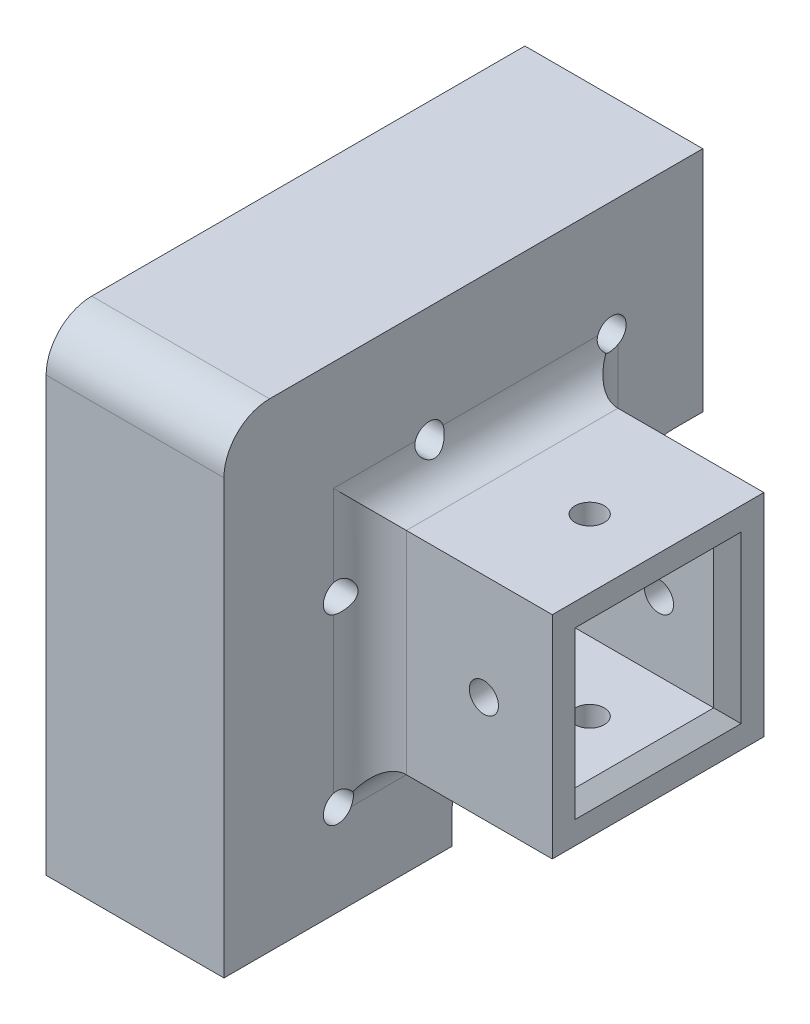
from build123d import *

# Parameters (mm, degrees)
SKETCH_1_R          = 1.6
SKETCH_1_W          = 15.2
SKETCH_1_H          = 15.2
EXTRUDE_1_DEPTH     = 19.5
CUT_EXTRUDE_1_DEPTH = 14.5
SKETCH_3_W          = 23.2
SKETCH_3_H          = 23.2
SKETCH_3_W_2        = 15.2
SKETCH_3_H_2        = 15.2
EXTRUDE_2_DEPTH     = 20
FILLET_1_R          = 4
FILLET_2_R          = 6
CHAMFER_1_SIZE      = 1.5
CHAMFER_2_SIZE      = 1
SKETCH_4_R          = 1.6
CUT_EXTRUDE_2_DEPTH = 68.026114314
SKETCH_5_R          = 1.6
CUT_EXTRUDE_3_DEPTH = 68.026114314
FILLET_3_R          = 5


with BuildPart() as part:
    # 草图1 → 凸台-拉伸1 (new body)
    with BuildSketch(Plane(origin=(0, 0, 0), x_dir=(0, 0, -1), z_dir=(1, 0, 0))):
        Polygon((12.5, -30.7), (30.7, -30.7), (30.7, -12.5), (40, -12.5), (40, 12.5), (-12.5, 12.5), (-12.5, -40), (12.5, -40), align=None)
        with Locations((10, 0)):
            Circle(SKETCH_1_R, mode=Mode.SUBTRACT)
        with Locations((30, 0)):
            Circle(SKETCH_1_R, mode=Mode.SUBTRACT)
        with Locations(Location((0, -30, 0), (0, 0, 180))):
            Circle(SKETCH_1_R, mode=Mode.SUBTRACT)
        with Locations(Location((0, -10, 0), (0, 0, 180))):
            Circle(SKETCH_1_R, mode=Mode.SUBTRACT)
        with Locations((15.1, -15.1)):
            Rectangle(SKETCH_1_W, SKETCH_1_H, mode=Mode.SUBTRACT)
    extrude(amount=EXTRUDE_1_DEPTH)

    # 草图2 → 切除-拉伸1 (cut)
    with BuildSketch(Plane.ZY):
        Polygon((7.5, 7.5), (7.5, -40), (-7.5, -40), (-7.5, -7.5), (-40, -7.5), (-40, 7.5), align=None)
    extrude(amount=-CUT_EXTRUDE_1_DEPTH, mode=Mode.SUBTRACT)

    # 草图3 → 凸台-拉伸2 (add)
    with BuildSketch(Plane(origin=(19.5, 0, 0), x_dir=(0, 0, -1), z_dir=(1, 0, 0))):
        with Locations((15.1, -15.1)):
            Rectangle(SKETCH_3_W, SKETCH_3_H)
        with Locations((15.1, -15.1)):
            Rectangle(SKETCH_3_W_2, SKETCH_3_H_2, mode=Mode.SUBTRACT)
    extrude(amount=EXTRUDE_2_DEPTH)

    # 圆角1
    # the kernel refuses this fillet: 4 mm, written as the material it adds along each edge
    with BuildSketch(Plane(origin=(19.5, -3.5, -3.5), x_dir=(0, 0, 1), z_dir=(0, -1, 0))) as fillet_1_piece_1_section:
        with BuildLine():
            CenterArc((FILLET_1_R, -FILLET_1_R), FILLET_1_R, 90, 90)
            Line((0, -FILLET_1_R), (0, 0))
            Line((0, 0), (FILLET_1_R, 0))
        make_face()
    fillet_1_piece_1 = extrude(amount=23.2, mode=Mode.PRIVATE)
    fillet_1_piece_1 = fillet_1_piece_1 - Plane(origin=(20.41689995, -10, 0), x_dir=(0, 0, 1), z_dir=(-1, 0, 0)) * Cylinder(1.6, 63, mode=Mode.PRIVATE)
    add(fillet_1_piece_1)
    with BuildSketch(Plane(origin=(19.5, -26.7, -3.5), x_dir=(0, -1, 0), z_dir=(0, 0, -1)), Plane(origin=(19.5, -26.7, -26.7), x_dir=(0, 0, -1), z_dir=(0, 1, 0))) as fillet_1_piece_2:
        with BuildLine():
            CenterArc((FILLET_1_R, -FILLET_1_R), FILLET_1_R, 90, 90)
            Line((0, -FILLET_1_R), (0, 0))
            Line((0, 0), (FILLET_1_R, 0))
        make_face()
    extrude(amount=23.2)
    with BuildSketch(Plane(origin=(19.5, -3.5, -26.7), x_dir=(0, 1, 0), z_dir=(0, 0, 1))) as fillet_1_piece_3_section:
        with BuildLine():
            CenterArc((FILLET_1_R, -FILLET_1_R), FILLET_1_R, 90, 90)
            Line((0, -FILLET_1_R), (0, 0))
            Line((0, 0), (FILLET_1_R, 0))
        make_face()
    fillet_1_piece_3 = extrude(amount=23.2, mode=Mode.PRIVATE)
    fillet_1_piece_3 = fillet_1_piece_3 - Plane(origin=(20.416900014, 0, -10), x_dir=(0, 0, -1), z_dir=(-1, 0, 0)) * Cylinder(1.6, 63, mode=Mode.PRIVATE)
    add(fillet_1_piece_3)
    with BuildSketch(Plane(origin=(19.5, -3.5, -26.7), x_dir=(0, 1, 0), z_dir=(0, 0, 1))) as fillet_1_piece_4a_section:
        with BuildLine():
            CenterArc((FILLET_1_R, -FILLET_1_R), FILLET_1_R, 90, 90)
            Line((0, -FILLET_1_R), (0, 0))
            Line((0, 0), (FILLET_1_R, 0))
        make_face()
    fillet_1_piece_4a = extrude(amount=33.2, mode=Mode.PRIVATE)
    fillet_1_piece_4a = split(fillet_1_piece_4a, bisect_by=Plane(origin=(20.405580457, -2.594419543, -3.5), z_dir=(0, 0, 1)), keep=Keep.TOP, mode=Mode.PRIVATE)
    with BuildSketch(Plane(origin=(19.5, 6.5, -3.5), x_dir=(0, 0, 1), z_dir=(0, -1, 0))) as fillet_1_piece_4b_section:
        with BuildLine():
            CenterArc((FILLET_1_R, -FILLET_1_R), FILLET_1_R, 90, 90)
            Line((0, -FILLET_1_R), (0, 0))
            Line((0, 0), (FILLET_1_R, 0))
        make_face()
    fillet_1_piece_4b = extrude(amount=33.2, mode=Mode.PRIVATE)
    fillet_1_piece_4b = split(fillet_1_piece_4b, bisect_by=Plane(origin=(20.405580457, -3.5, -2.594419543), z_dir=(0, 1, 0)), keep=Keep.TOP, mode=Mode.PRIVATE)
    fillet_1_piece_4 = fillet_1_piece_4a & fillet_1_piece_4b
    add(fillet_1_piece_4)
    with BuildSketch(Plane(origin=(19.5, -26.7, 6.5), x_dir=(0, -1, 0), z_dir=(0, 0, -1))) as fillet_1_piece_5a_section:
        with BuildLine():
            CenterArc((FILLET_1_R, -FILLET_1_R), FILLET_1_R, 90, 90)
            Line((0, -FILLET_1_R), (0, 0))
            Line((0, 0), (FILLET_1_R, 0))
        make_face()
    fillet_1_piece_5a = extrude(amount=33.2, mode=Mode.PRIVATE)
    fillet_1_piece_5a = fillet_1_piece_5a - Plane(origin=(20.438690709, -30, 0), x_dir=(0, 0, 1), z_dir=(-1, 0, 0)) * Cylinder(1.6, 83, mode=Mode.PRIVATE)
    fillet_1_piece_5a = split(fillet_1_piece_5a, bisect_by=Plane(origin=(20.438690709, -27.535460333, -3.5), z_dir=(0, 0, 1)), keep=Keep.TOP, mode=Mode.PRIVATE)
    with BuildSketch(Plane(origin=(19.5, -3.5, -3.5), x_dir=(0, 0, 1), z_dir=(0, -1, 0))) as fillet_1_piece_5b_section:
        with BuildLine():
            CenterArc((FILLET_1_R, -FILLET_1_R), FILLET_1_R, 90, 90)
            Line((0, -FILLET_1_R), (0, 0))
            Line((0, 0), (FILLET_1_R, 0))
        make_face()
    fillet_1_piece_5b = extrude(amount=33.2, mode=Mode.PRIVATE)
    fillet_1_piece_5b = fillet_1_piece_5b - Plane(origin=(20.432327139, -30, 0), x_dir=(0, 0, 1), z_dir=(-1, 0, 0)) * Cylinder(1.6, 83, mode=Mode.PRIVATE)
    fillet_1_piece_5b = split(fillet_1_piece_5b, bisect_by=Plane(origin=(20.432327139, -26.7, -2.653974982), z_dir=(0, -1, 0)), keep=Keep.TOP, mode=Mode.PRIVATE)
    fillet_1_piece_5 = fillet_1_piece_5a & fillet_1_piece_5b
    add(fillet_1_piece_5)
    with BuildSketch(Plane(origin=(19.5, -26.7, -3.5), x_dir=(0, -1, 0), z_dir=(0, 0, -1))) as fillet_1_piece_6a_section:
        with BuildLine():
            CenterArc((FILLET_1_R, -FILLET_1_R), FILLET_1_R, 90, 90)
            Line((0, -FILLET_1_R), (0, 0))
            Line((0, 0), (FILLET_1_R, 0))
        make_face()
    fillet_1_piece_6a = extrude(amount=33.2, mode=Mode.PRIVATE)
    fillet_1_piece_6a = split(fillet_1_piece_6a, bisect_by=Plane(origin=(20.405580457, -27.605580457, -30.7), z_dir=(0, 0, 1)), keep=Keep.TOP, mode=Mode.PRIVATE)
    fillet_1_piece_6a = split(fillet_1_piece_6a, bisect_by=Plane(origin=(20.405580457, -27.605580457, -26.7), z_dir=(0, 0, -1)), keep=Keep.TOP, mode=Mode.PRIVATE)
    with BuildSketch(Plane(origin=(19.5, -36.7, -26.7), x_dir=(0, 0, -1), z_dir=(0, 1, 0))) as fillet_1_piece_6b_section:
        with BuildLine():
            CenterArc((FILLET_1_R, -FILLET_1_R), FILLET_1_R, 90, 90)
            Line((0, -FILLET_1_R), (0, 0))
            Line((0, 0), (FILLET_1_R, 0))
        make_face()
    fillet_1_piece_6b = extrude(amount=33.2, mode=Mode.PRIVATE)
    fillet_1_piece_6b = split(fillet_1_piece_6b, bisect_by=Plane(origin=(20.405580457, -30.7, -27.605580457), z_dir=(0, 1, 0)), keep=Keep.TOP, mode=Mode.PRIVATE)
    fillet_1_piece_6b = split(fillet_1_piece_6b, bisect_by=Plane(origin=(20.405580457, -26.7, -27.605580457), z_dir=(0, -1, 0)), keep=Keep.TOP, mode=Mode.PRIVATE)
    fillet_1_piece_6 = fillet_1_piece_6a & fillet_1_piece_6b
    add(fillet_1_piece_6)
    with BuildSketch(Plane(origin=(19.5, -26.7, -26.7), x_dir=(0, 0, -1), z_dir=(0, 1, 0))) as fillet_1_piece_7a_section:
        with BuildLine():
            CenterArc((FILLET_1_R, -FILLET_1_R), FILLET_1_R, 90, 90)
            Line((0, -FILLET_1_R), (0, 0))
            Line((0, 0), (FILLET_1_R, 0))
        make_face()
    fillet_1_piece_7a = extrude(amount=33.2, mode=Mode.PRIVATE)
    fillet_1_piece_7a = fillet_1_piece_7a - Plane(origin=(20.438690575, 0, -30), x_dir=(0, 0, -1), z_dir=(-1, 0, 0)) * Cylinder(1.6, 83, mode=Mode.PRIVATE)
    fillet_1_piece_7a = split(fillet_1_piece_7a, bisect_by=Plane(origin=(20.438690575, -3.5, -27.535460712), z_dir=(0, 1, 0)), keep=Keep.TOP, mode=Mode.PRIVATE)
    with BuildSketch(Plane(origin=(19.5, -3.5, -36.7), x_dir=(0, 1, 0), z_dir=(0, 0, 1))) as fillet_1_piece_7b_section:
        with BuildLine():
            CenterArc((FILLET_1_R, -FILLET_1_R), FILLET_1_R, 90, 90)
            Line((0, -FILLET_1_R), (0, 0))
            Line((0, 0), (FILLET_1_R, 0))
        make_face()
    fillet_1_piece_7b = extrude(amount=33.2, mode=Mode.PRIVATE)
    fillet_1_piece_7b = fillet_1_piece_7b - Plane(origin=(20.432327238, 0, -30), x_dir=(0, 0, -1), z_dir=(-1, 0, 0)) * Cylinder(1.6, 83, mode=Mode.PRIVATE)
    fillet_1_piece_7b = split(fillet_1_piece_7b, bisect_by=Plane(origin=(20.432327238, -2.653975394, -26.7), z_dir=(0, 0, -1)), keep=Keep.TOP, mode=Mode.PRIVATE)
    fillet_1_piece_7 = fillet_1_piece_7a & fillet_1_piece_7b
    add(fillet_1_piece_7)

    # 圆角2
    # the kernel refuses this fillet: 6 mm, written as the material it adds along each edge
    with BuildSketch(Plane(origin=(0, -30.7, -12.5), x_dir=(0, 0, -1), z_dir=(1, 0, 0)), Plane(origin=(0, -12.5, -30.7), x_dir=(0, 0, -1), z_dir=(1, 0, 0))) as fillet_2_piece_1:
        with BuildLine():
            CenterArc((FILLET_2_R, -FILLET_2_R), FILLET_2_R, 90, 90)
            Line((0, -FILLET_2_R), (0, 0))
            Line((0, 0), (FILLET_2_R, 0))
        make_face()
    extrude(amount=19.5)
    # the kernel refuses this fillet: 6 mm, written as the material it takes off along each edge
    with BuildSketch(Plane(origin=(-15, -30.7, -30.7), x_dir=(0, 0, 1), z_dir=(1, 0, 0))) as fillet_2_2_piece_1:
        with BuildLine():
            CenterArc((FILLET_2_R, -FILLET_2_R), FILLET_2_R, 90, 90)
            Line((0, -FILLET_2_R), (0, 0))
            Line((0, 0), (FILLET_2_R, 0))
        make_face()
    extrude(amount=49.5, mode=Mode.SUBTRACT)

    # 倒角1
    chamfer_1_edges = [part.edges().sort_by_distance(p)[0] for p in [
        (39.5, -15.1, -7.5),
        (39.5, -22.7, -15.1),
        (39.5, -15.1, -22.7),
        (39.5, -7.5, -15.1),
    ]]
    chamfer(chamfer_1_edges, length=CHAMFER_1_SIZE)

    # 倒角2
    chamfer_2_edges = [part.edges().sort_by_distance(p)[0] for p in [
        (0, 7.5, -16.25),
        (0, -7.5, -31.35),
        (0, -31.35, -7.5),
        (0, -16.25, 7.5),
    ]]
    chamfer(chamfer_2_edges, length=CHAMFER_2_SIZE)

    # 草图4 → 切除-拉伸2 (cut, through all)
    with BuildSketch(Plane.XY.offset(-3.5)):
        with Locations((32, -15.1)):
            Circle(SKETCH_4_R)
    extrude(amount=-CUT_EXTRUDE_2_DEPTH, mode=Mode.SUBTRACT)

    # 草图5 → 切除-拉伸3 (cut, through all)
    with BuildSketch(Plane(origin=(0, -3.5, 0), x_dir=(1, 0, 0), z_dir=(0, 1, 0))):
        with Locations(Location((32, 15.1, 0), (0, 0, 270))):
            Circle(SKETCH_5_R)
    extrude(amount=-CUT_EXTRUDE_3_DEPTH, mode=Mode.SUBTRACT)

    # 圆角3
    fillet_3_edges = [part.edges().sort_by_distance(p)[0] for p in [
        (9.75, 12.5, 12.5),
    ]]
    fillet(fillet_3_edges, radius=FILLET_3_R)


solid = part.part
